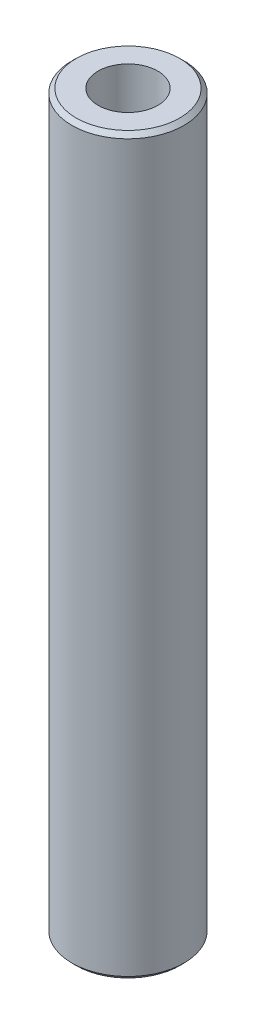
from build123d import *
from OCP.BRepFilletAPI import BRepFilletAPI_MakeChamfer

# Parameters (mm, degrees)
SKETCH1_R           = 45
BOSS_EXTRUDE1_DEPTH = 589.345693844
SKETCH2_R           = 23.935480614
CUT_EXTRUDE1_DEPTH  = 593.771749371
CHAMFER1_SIZE       = 3.395767112
CHAMFER1_SIZE2      = 3.47621681


with BuildPart() as part:
    # Sketch1 → Boss-Extrude1 (new body)
    with BuildSketch(Plane(origin=(0, 0, 0), x_dir=(1, 0, 0), z_dir=(0, 1, 0))):
        Circle(SKETCH1_R)
    extrude(amount=BOSS_EXTRUDE1_DEPTH)

    # Sketch2 → Cut-Extrude1 (cut, through all)
    with BuildSketch(Plane(origin=(0, 0, 0), x_dir=(1, 0, 0), z_dir=(0, 1, 0))):
        Circle(SKETCH2_R)
    extrude(amount=CUT_EXTRUDE1_DEPTH, mode=Mode.SUBTRACT)

    # Chamfer1: one chamfer whose edges measure the first distance from different faces: ONE call of the kernel's chamfer builder (chamfer() names one face for all edges)
    chamfer1_edges_1 = [part.edges().sort_by_distance(p)[0] for p in [
        (-45, 589.345693844, 0),
    ]]
    chamfer1_side_1 = [part.faces().sort_by_distance(p)[0] for p in [
        (-45, 294.672846922, 0),
    ]]
    chamfer1_edges_2 = [part.edges().sort_by_distance(p)[0] for p in [
        (-45, 0, 0),
    ]]
    chamfer1_side_2 = [part.faces().sort_by_distance(p)[0] for p in [
        (-43.727207794, 0, 0),
    ]]
    chamfer1 = BRepFilletAPI_MakeChamfer(part.part.solid().wrapped)
    for e in chamfer1_edges_1:
        chamfer1.Add(CHAMFER1_SIZE, CHAMFER1_SIZE2, e.wrapped, chamfer1_side_1[0].wrapped)  # the first distance lies on this face
    for e in chamfer1_edges_2:
        chamfer1.Add(CHAMFER1_SIZE, CHAMFER1_SIZE2, e.wrapped, chamfer1_side_2[0].wrapped)  # the first distance lies on this face
    add(Compound.cast(chamfer1.Shape()), mode=Mode.REPLACE)


solid = part.part
